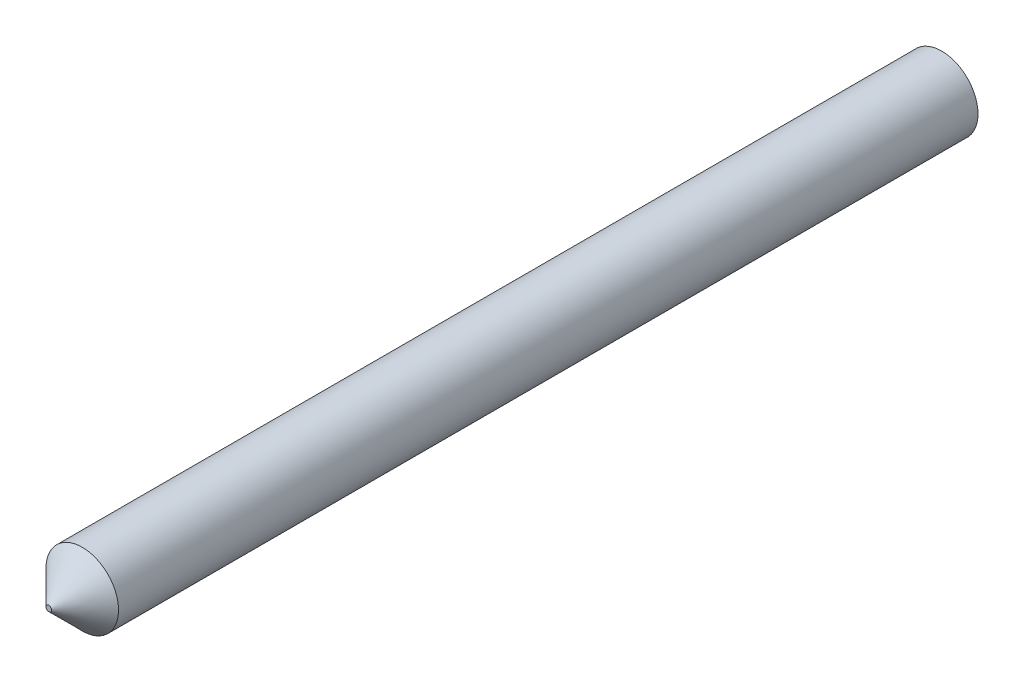
from build123d import *

# Parameters (mm, degrees)
CROQUIS1_R              = 1.625
SALIENTE_EXTRUIR1_DEPTH = 40
CHAFL_N1_SIZE           = 1.5


with BuildPart() as part:
    # Croquis1 → Saliente-Extruir1 (new body)
    with BuildSketch(Plane.XY):
        Circle(CROQUIS1_R)
    extrude(amount=SALIENTE_EXTRUIR1_DEPTH)

    # Chaflán1
    chafl_n1_edges = [part.edges().sort_by_distance(p)[0] for p in [
        (-1.625, 0, 40),
    ]]
    chamfer(chafl_n1_edges, length=CHAFL_N1_SIZE)


solid = part.part
